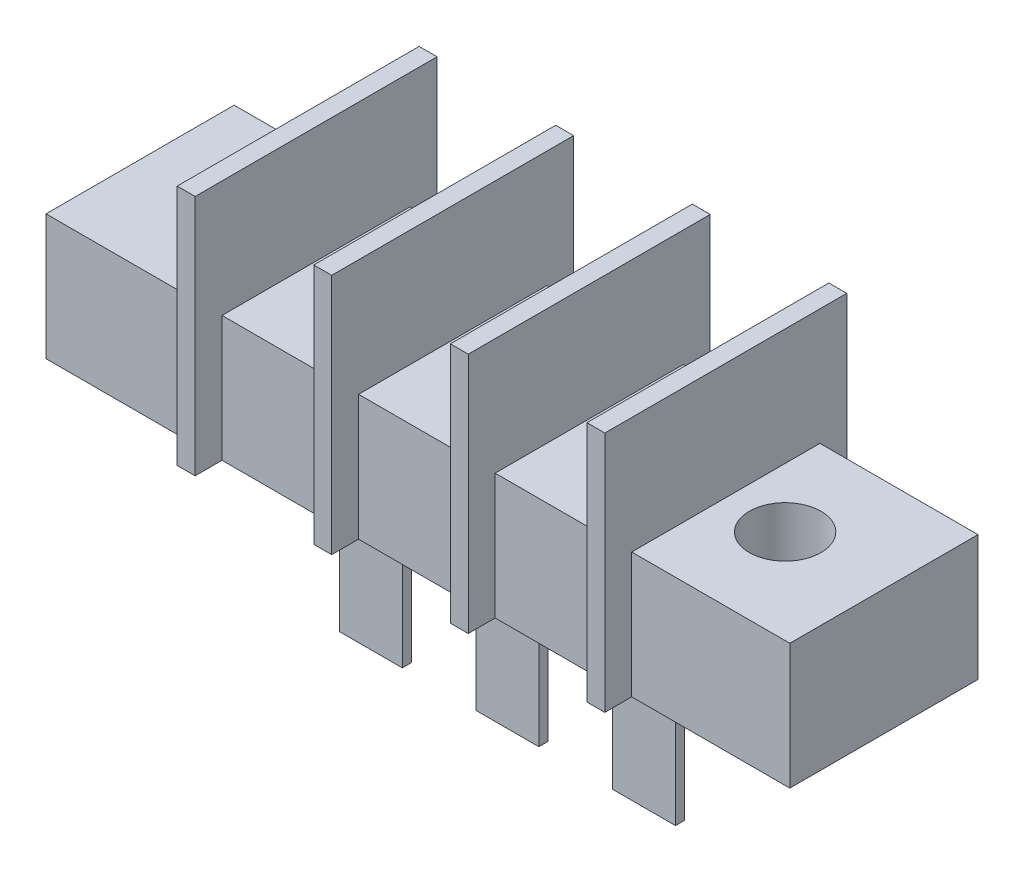
from build123d import *

# Parameters (mm, degrees)
SKETCH_1_W           = 41.5
SKETCH_1_H           = 13.5
EXTRUDE_1_DEPTH      = 13.5
SKETCH_6_W           = 3.5
SKETCH_6_H           = 0.5
EXTRUDE_2_DEPTH      = 10
SKETCH_7_OUTSIDE_W   = 53.414
SKETCH_7_OUTSIDE_H   = 25.414
SKETCH_7_OUTSIDE_W_2 = 1
SKETCH_7_OUTSIDE_H_2 = 13.5
CUT_EXTRUDE_1_DEPTH  = 6.5
SKETCH_8_W           = 8.82
SKETCH_8_H           = 7
SKETCH_8_W_2         = 6.62
CUT_EXTRUDE_2_DEPTH  = 1.5
SKETCH_9_R           = 2
CUT_EXTRUDE_3_DEPTH  = 28.660892972


with BuildPart() as part:
    # 草图1 → 拉伸1 (new body)
    with BuildSketch(Plane(origin=(0, 0, 0), x_dir=(1, 0, 0), z_dir=(0, 1, 0))):
        Rectangle(SKETCH_1_W, SKETCH_1_H)
    extrude(amount=EXTRUDE_1_DEPTH)

    # 草图6 → 拉伸2 (add)
    with BuildSketch(Plane.XZ):
        Rectangle(SKETCH_6_W, SKETCH_6_H)
        with Locations((7.62, 0)):
            Rectangle(SKETCH_6_W, SKETCH_6_H)
        with Locations((-7.62, 0)):
            Rectangle(SKETCH_6_W, SKETCH_6_H)
    extrude(amount=EXTRUDE_2_DEPTH)

    # 草图7 outside → 切除-拉伸1 (cut)
    with BuildSketch(Plane(origin=(0, 13.5, 0), x_dir=(1, 0, 0), z_dir=(0, 1, 0))):
        Rectangle(SKETCH_7_OUTSIDE_W, SKETCH_7_OUTSIDE_H)
        with Locations((-3.81, 0)):
            Rectangle(SKETCH_7_OUTSIDE_W_2, SKETCH_7_OUTSIDE_H_2, mode=Mode.SUBTRACT)
        with Locations((3.81, 0)):
            Rectangle(SKETCH_7_OUTSIDE_W_2, SKETCH_7_OUTSIDE_H_2, mode=Mode.SUBTRACT)
        with Locations((11.43, 0)):
            Rectangle(SKETCH_7_OUTSIDE_W_2, SKETCH_7_OUTSIDE_H_2, mode=Mode.SUBTRACT)
        with Locations((-11.43, 0)):
            Rectangle(SKETCH_7_OUTSIDE_W_2, SKETCH_7_OUTSIDE_H_2, mode=Mode.SUBTRACT)
    extrude(amount=-CUT_EXTRUDE_1_DEPTH, mode=Mode.SUBTRACT)

    # 草图8 → 切除-拉伸2 (cut)
    with BuildSketch(Plane.XY.offset(6.75)):
        with Locations((-16.34, 3.5)):
            Rectangle(SKETCH_8_W, SKETCH_8_H)
        with Locations((-7.62, 3.5)):
            Rectangle(SKETCH_8_W_2, SKETCH_8_H)
        with Locations((0, 3.5)):
            Rectangle(SKETCH_8_W_2, SKETCH_8_H)
        with Locations((7.62, 3.5)):
            Rectangle(SKETCH_8_W_2, SKETCH_8_H)
        with Locations((16.34, 3.5)):
            Rectangle(SKETCH_8_W, SKETCH_8_H)
    cut_extrude_2 = extrude(amount=-CUT_EXTRUDE_2_DEPTH, mode=Mode.SUBTRACT)

    # 镜向1: 切除-拉伸2 across plane
    add(cut_extrude_2.mirror(Plane.XY), mode=Mode.SUBTRACT)

    # 草图9 → 切除-拉伸3 (cut, through all)
    with BuildSketch(Plane(origin=(0, 7, 0), x_dir=(1, 0, 0), z_dir=(0, 1, 0))):
        with Locations((-15.24, 0)):
            Circle(SKETCH_9_R)
        with Locations((15.24, 0)):
            Circle(SKETCH_9_R)
    extrude(amount=-CUT_EXTRUDE_3_DEPTH, mode=Mode.SUBTRACT)


solid = part.part
